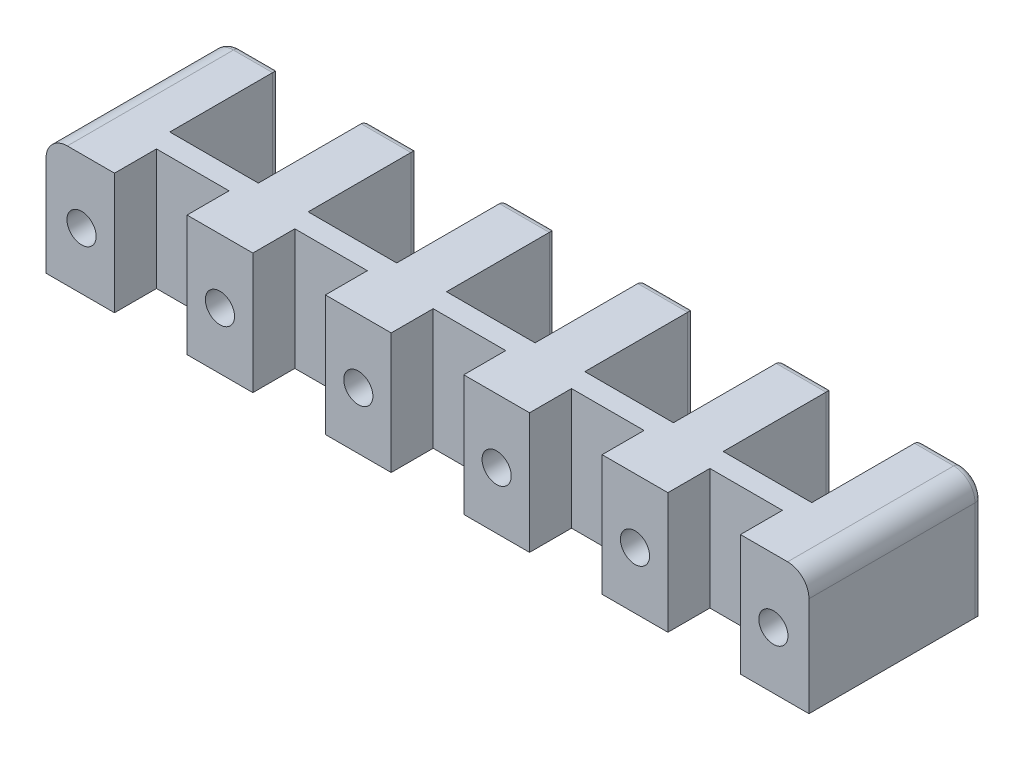
from build123d import *

# Parameters (mm, degrees)
SKETCH1_W           = 12.45
SKETCH1_H           = 21.45
BOSS_EXTRUDE1_DEPTH = 18
SKETCH2_W           = 10
SKETCH2_H           = 3
BOSS_EXTRUDE2_DEPTH = 18
SKETCH4_W           = 7
SKETCH4_H           = 8.185466936
SKETCH4_H_2         = 9.121133548
SKETCH4_H_3         = 13.415591142
SKETCH4_H_4         = 10.11507115
SKETCH4_H_5         = 8.575799248
CUT_EXTRUDE2_DEPTH  = 6
FILLET3_R           = 3.5
FILLET4_R           = 2
SKETCH5_R           = 1.6
CUT_EXTRUDE3_DEPTH  = 105.163684291
CUT_EXTRUDE4_DEPTH  = 105.163684291
SKETCH10_W          = 7.3675
SKETCH10_H          = 18
SKETCH10_R          = 1.6
BOSS_EXTRUDE4_DEPTH = 21.45
FILLET6_R           = 3
SKETCH11_W          = 114.139507882
SKETCH11_H          = 1
CUT_EXTRUDE5_DEPTH  = 97.285728563
CHAMFER1_SIZE       = 1
CHAMFER2_SIZE       = 1
FILLET7_R           = 1
FILLET8_R           = 1
FILLET9_R           = 1
SKETCH13_R          = 2.05
CUT_EXTRUDE6_DEPTH  = 8
SKETCH14_R          = 2.05
CUT_EXTRUDE7_DEPTH  = 10
SKETCH15_W          = 114.000331722
SKETCH15_H          = 33.1435942
CUT_EXTRUDE9_DEPTH  = 97.285728563


with BuildPart() as part:
    # Sketch1 → Boss-Extrude1 (new body)
    with BuildSketch(Plane(origin=(0, 0, 0), x_dir=(1, 0, 0), z_dir=(0, 1, 0))):
        Polygon((-19.225, -19.625), (-5.1, -19.625), (-5.1, -13.725), (5.1, -13.725), (5.1, -19.625), (14.35, -19.625), (14.35, -13.725), (24.55, -13.725), (24.55, -19.625), (33.8, -19.625), (33.8, -13.725), (44, -13.725), (44, -19.625), (53.25, -19.625), (53.25, -13.725), (63.45, -13.725), (63.45, -19.625), (72.7, -19.625), (72.7, -13.725), (82.9, -13.725), (82.9, -19.625), (97.025, -19.625), (97.025, -10.725), (87.025, -10.725), (87.025, 13.725), (-9.225, 13.725), (-9.225, -10.725), (-19.225, -10.725), align=None)
        Rectangle(SKETCH1_W, SKETCH1_H, mode=Mode.SUBTRACT)
        with Locations((19.45, 0)):
            Rectangle(SKETCH1_W, SKETCH1_H, mode=Mode.SUBTRACT)
        with Locations((38.9, 0)):
            Rectangle(SKETCH1_W, SKETCH1_H, mode=Mode.SUBTRACT)
        with Locations((58.35, 0)):
            Rectangle(SKETCH1_W, SKETCH1_H, mode=Mode.SUBTRACT)
        with Locations((77.8, 0)):
            Rectangle(SKETCH1_W, SKETCH1_H, mode=Mode.SUBTRACT)
    extrude(amount=BOSS_EXTRUDE1_DEPTH)

    # Sketch2 → Boss-Extrude2 (add)
    with BuildSketch(Plane(origin=(0, 18, 0), x_dir=(1, 0, 0), z_dir=(0, 1, 0))):
        with Locations((-14.225, -9.225)):
            Rectangle(SKETCH2_W, SKETCH2_H)
        with Locations((92.025, -9.225)):
            Rectangle(SKETCH2_W, SKETCH2_H)
    extrude(amount=-BOSS_EXTRUDE2_DEPTH)

    # Sketch4 → Cut-Extrude2 (cut)
    with BuildSketch(Plane(origin=(0, 18, 0), x_dir=(1, 0, 0), z_dir=(0, 1, 0))):
        with Locations((0, 10.725)):
            Rectangle(SKETCH4_W, SKETCH4_H)
        with Locations((19.45, 10.725)):
            Rectangle(SKETCH4_W, SKETCH4_H_2)
        with Locations((38.9, 10.725)):
            Rectangle(SKETCH4_W, SKETCH4_H_3)
        with Locations((58.35, 10.725)):
            Rectangle(SKETCH4_W, SKETCH4_H_4)
        with Locations((77.8, 10.725)):
            Rectangle(SKETCH4_W, SKETCH4_H_5)
    extrude(amount=-CUT_EXTRUDE2_DEPTH, mode=Mode.SUBTRACT)

    # Fillet3
    fillet3_edges = [part.edges().sort_by_distance(p)[0] for p in [
        (81.3, 12, -12.225),
        (74.3, 12, -12.225),
        (54.85, 12, -12.225),
        (61.85, 12, -12.225),
        (42.4, 12, -12.225),
        (35.4, 12, -12.225),
        (15.95, 12, -12.225),
        (22.95, 12, -12.225),
        (3.5, 12, -12.225),
        (-3.5, 12, -12.225),
    ]]
    fillet(fillet3_edges, radius=FILLET3_R - 0.0001)  # a hair under: the kernel refuses the full size

    # Fillet4
    fillet4_edges = [part.edges().sort_by_distance(p)[0] for p in [
        (74.3, 18, -12.225),
        (81.3, 18, -12.225),
        (54.85, 18, -12.225),
        (61.85, 18, -12.225),
        (35.4, 18, -12.225),
        (42.4, 18, -12.225),
        (15.95, 18, -12.225),
        (22.95, 18, -12.225),
        (-3.5, 18, -12.225),
        (3.5, 18, -12.225),
    ]]
    fillet(fillet4_edges, radius=FILLET4_R)

    # Sketch5 → Cut-Extrude3 (cut, through all)
    with BuildSketch(Plane.XY.offset(19.625)):
        with Locations((9.725, 9)):
            Circle(SKETCH5_R)
        with Locations((29.175, 9)):
            Circle(SKETCH5_R)
        with Locations((48.625, 9)):
            Circle(SKETCH5_R)
        with Locations((68.075, 9)):
            Circle(SKETCH5_R)
        with Locations((87.53, 9)):
            Circle(SKETCH5_R)
        with Locations((-9.73, 9)):
            Circle(SKETCH5_R)
    extrude(amount=-CUT_EXTRUDE3_DEPTH, mode=Mode.SUBTRACT)

    # Sketch7 → Cut-Extrude4 (cut, through all)
    with BuildSketch(Plane(origin=(0, 0, -13.725), x_dir=(-1, 0, 0), z_dir=(0, 0, -1))):
        Polygon((-92.53, 9), (-92.53, -2.934603673), (-102.870987394, -2.934603673), (-102.870987394, 21.319522162), (-92.53, 21.319522162), align=None)
        Polygon((14.73, 9), (14.73, -3.337317556), (26.94038456, -3.337317556), (26.94038456, 20.180651888), (14.73, 20.180651888), align=None)
    extrude(amount=-CUT_EXTRUDE4_DEPTH, mode=Mode.SUBTRACT)

    # Sketch10 → Boss-Extrude4 (add)
    # profile 1 of 2: a face of its own
    with BuildSketch(Plane(origin=(0, 0, 7.725), x_dir=(-1, 0, 0), z_dir=(0, 0, -1))):
        with Locations((-88.84625, 9)):
            Rectangle(SKETCH10_W, SKETCH10_H)
        with Locations(Location((-87.53, 9, 0), (0, 0, 180))):
            Circle(SKETCH10_R, mode=Mode.SUBTRACT)
    # profile 2 of 2: a face of its own
    with BuildSketch(Plane(origin=(0, 0, 7.725), x_dir=(-1, 0, 0), z_dir=(0, 0, -1))):
        with Locations((11.04625, 9)):
            Rectangle(SKETCH10_W, SKETCH10_H)
        with Locations(Location((9.73, 9, 0), (0, 0, 180))):
            Circle(SKETCH10_R, mode=Mode.SUBTRACT)
    extrude(amount=BOSS_EXTRUDE4_DEPTH)

    # Fillet6
    fillet6_edges = [part.edges().sort_by_distance(p)[0] for p in [
        (92.53, 18, 2.95),
        (-14.73, 18, 2.95),
    ]]
    fillet(fillet6_edges, radius=FILLET6_R)

    # Sketch11 → Cut-Extrude5 (cut, through all)
    with BuildSketch(Plane(origin=(0, 18, 0), x_dir=(1, 0, 0), z_dir=(0, 1, 0))):
        with Locations((38.937615411, 5.225)):
            Rectangle(SKETCH11_W, SKETCH11_H)
    extrude(amount=-CUT_EXTRUDE5_DEPTH, mode=Mode.SUBTRACT)


with BuildPart() as cut_extrude5_piece_1:
    # of the separate pieces the step leaves, piece 1, a body of its own (cut_extrude5_pieces)
    add(part.part.solids().sort_by_distance((-11.73, 18, -4.725))[0])

    # Chamfer2
    chamfer2_edges = [cut_extrude5_piece_1.edges().sort_by_distance(p)[0] for p in [
        (-9.915, 0, 19.625),
        (-14.73, 0, 7.45),
        (68.075, 0, 19.625),
        (63.45, 0, 16.675),
        (58.35, 0, 13.725),
        (53.25, 0, 16.675),
        (48.625, 0, 19.625),
        (44, 0, 16.675),
        (38.9, 0, 13.725),
        (33.8, 0, 16.675),
        (29.175, 0, 19.625),
        (24.55, 0, 16.675),
        (19.45, 0, 13.725),
        (14.35, 0, 16.675),
        (9.725, 0, 19.625),
        (5.1, 0, 16.675),
        (0, 0, 13.725),
        (-5.1, 0, 16.675),
        (92.53, 0, 7.45),
        (-6.225, 0, 3),
        (6.225, 0, 3),
        (25.675, 0, 3),
        (87.715, 0, 19.625),
        (13.225, 0, 3),
        (45.125, 0, 3),
        (32.675, 0, 3),
        (64.575, 0, 3),
        (52.125, 0, 3),
        (84.025, 0, 3),
        (71.575, 0, 3),
        (82.9, 0, 16.675),
        (77.8, 0, 13.725),
        (72.7, 0, 16.675),
        (77.8, 0, 10.725),
        (9.725, 0, -4.725),
        (88.2775, 0, -4.725),
        (68.075, 0, -4.725),
        (48.625, 0, -4.725),
        (29.175, 0, -4.725),
        (-10.4775, 0, -4.725),
        (58.35, 0, 10.725),
        (38.9, 0, 10.725),
        (19.45, 0, 10.725),
        (0, 0, 10.725),
    ]]
    chamfer(chamfer2_edges, length=CHAMFER2_SIZE)

    # Fillet7
    fillet7_edges = [cut_extrude5_piece_1.edges().sort_by_distance(p)[0] for p in [
        (91.651320344, 17.121320344, -4.725),
        (71.575, 9.5, -4.725),
        (52.125, 9.5, -4.725),
        (32.675, 9.5, -4.725),
        (13.225, 9.5, -4.725),
        (6.225, 9.5, -4.725),
        (84.025, 9.5, -4.725),
        (64.575, 9.5, -4.725),
        (45.125, 9.5, -4.725),
        (25.675, 9.5, -4.725),
        (-6.225, 9.5, -4.725),
        (-14.73, 8, -4.725),
        (-13.851320344, 17.121320344, -4.725),
        (9.725, 18, -4.725),
        (86.7775, 18, -4.725),
        (68.075, 18, -4.725),
        (48.625, 18, -4.725),
        (29.175, 18, -4.725),
        (-8.9775, 18, -4.725),
        (92.53, 8, -4.725),
    ]]
    fillet(fillet7_edges, radius=FILLET7_R)

    # Sketch13 → Cut-Extrude6 (cut)
    with BuildSketch(Plane.XY.offset(19.625)):
        with Locations((-9.73, 9)):
            Circle(SKETCH13_R)
        with Locations((9.725, 9)):
            Circle(SKETCH13_R)
        with Locations((29.175, 9)):
            Circle(SKETCH13_R)
        with Locations((48.625, 9)):
            Circle(SKETCH13_R)
        with Locations((68.075, 9)):
            Circle(SKETCH13_R)
        with Locations((87.53, 9)):
            Circle(SKETCH13_R)
    extrude(amount=-CUT_EXTRUDE6_DEPTH, mode=Mode.SUBTRACT)

    # Sketch14 → Cut-Extrude7 (cut)
    with BuildSketch(Plane(origin=(0, 0, -4.725), x_dir=(-1, 0, 0), z_dir=(0, 0, -1))):
        with Locations(Location((-87.53, 9, 0), (0, 0, 180))):
            Circle(SKETCH14_R)
        with Locations(Location((-68.075, 9, 0), (0, 0, 180))):
            Circle(SKETCH14_R)
        with Locations(Location((-48.625, 9, 0), (0, 0, 180))):
            Circle(SKETCH14_R)
        with Locations(Location((-29.175, 9, 0), (0, 0, 180))):
            Circle(SKETCH14_R)
        with Locations(Location((-9.725, 9, 0), (0, 0, 180))):
            Circle(SKETCH14_R)
        with Locations(Location((9.73, 9, 0), (0, 0, 180))):
            Circle(SKETCH14_R)
    extrude(amount=-CUT_EXTRUDE7_DEPTH, mode=Mode.SUBTRACT)


with BuildPart() as cut_extrude5_piece_2:
    # of the separate pieces the step leaves, piece 2, a body of its own (cut_extrude5_pieces)
    add(part.part.solids().sort_by_distance((-11.73, 18, -13.725))[0])

    # Chamfer1
    chamfer1_edges = [cut_extrude5_piece_2.edges().sort_by_distance(p)[0] for p in [
        (77.8, 0, -10.725),
        (58.35, 0, -10.725),
        (38.9, 0, -10.725),
        (6.225, 0, -8.225),
        (19.45, 0, -10.725),
        (0, 0, -10.725),
        (84.025, 0, -8.225),
        (64.575, 0, -8.225),
        (45.125, 0, -8.225),
        (25.675, 0, -8.225),
        (92.53, 0, -9.725),
        (88.2775, 0, -5.725),
        (71.575, 0, -8.225),
        (68.075, 0, -5.725),
        (52.125, 0, -8.225),
        (48.625, 0, -5.725),
        (32.675, 0, -8.225),
        (29.175, 0, -5.725),
        (13.225, 0, -8.225),
        (9.725, 0, -5.725),
        (-6.225, 0, -8.225),
        (-10.4775, 0, -5.725),
        (-14.73, 0, -9.725),
        (38.9, 0, -13.725),
    ]]
    chamfer(chamfer1_edges, length=CHAMFER1_SIZE)

    # Fillet8
    fillet8_edges = [cut_extrude5_piece_2.edges().sort_by_distance(p)[0] for p in [
        (-14.73, 8, -5.725),
        (-6.225, 9.5, -5.725),
        (6.225, 9.5, -5.725),
        (13.225, 9.5, -5.725),
        (25.675, 9.5, -5.725),
        (32.675, 9.5, -5.725),
        (45.125, 9.5, -5.725),
        (52.125, 9.5, -5.725),
        (64.575, 9.5, -5.725),
        (71.575, 9.5, -5.725),
        (84.025, 9.5, -5.725),
        (91.651320344, 17.121320344, -5.725),
        (86.7775, 18, -5.725),
        (-8.9775, 18, -5.725),
        (-13.851320344, 17.121320344, -5.725),
        (9.725, 18, -5.725),
        (29.175, 18, -5.725),
        (48.625, 18, -5.725),
        (68.075, 18, -5.725),
        (92.53, 8, -5.725),
    ]]
    fillet(fillet8_edges, radius=FILLET8_R)

    # Fillet9
    fillet9_edges = [cut_extrude5_piece_2.edges().sort_by_distance(p)[0] for p in [
        (-2.474903023, 13.025096977, -13.725),
        (2.474903023, 13.025096977, -13.725),
        (4.085786438, 17.414213562, -13.725),
        (9.725, 18, -13.725),
        (15.364213562, 17.414213562, -13.725),
        (16.975096977, 13.025096977, -13.725),
        (21.924903023, 13.025096977, -13.725),
        (23.535786438, 17.414213562, -13.725),
        (29.175, 18, -13.725),
        (34.814213562, 17.414213562, -13.725),
        (36.425096977, 13.025096977, -13.725),
        (41.374903023, 13.025096977, -13.725),
        (42.985786438, 17.414213562, -13.725),
        (48.625, 18, -13.725),
        (54.264213562, 17.414213562, -13.725),
        (55.875096977, 13.025096977, -13.725),
        (60.824903023, 13.025096977, -13.725),
        (62.435786438, 17.414213562, -13.725),
        (68.075, 18, -13.725),
        (73.714213562, 17.414213562, -13.725),
        (75.325096977, 13.025096977, -13.725),
        (80.274903023, 13.025096977, -13.725),
        (81.885786438, 17.414213562, -13.725),
        (86.415, 18, -13.725),
        (91.651320344, 17.121320344, -13.725),
        (92.53, 8, -13.725),
        (-14.73, 8, -13.725),
        (81.3, 15.74995, -13.725),
        (74.3, 15.74995, -13.725),
        (61.85, 15.74995, -13.725),
        (54.85, 15.74995, -13.725),
        (42.4, 15.74995, -13.725),
        (35.4, 15.74995, -13.725),
        (22.95, 15.74995, -13.725),
        (15.95, 15.74995, -13.725),
        (3.5, 15.74995, -13.725),
        (-3.5, 15.74995, -13.725),
        (-13.851320344, 17.121320344, -13.725),
        (-8.615, 18, -13.725),
        (-4.085786438, 17.414213562, -13.725),
    ]]
    fillet(fillet9_edges, radius=FILLET9_R)

    # Sketch15 → Cut-Extrude9 (cut, through all)
    with BuildSketch(Plane.XZ):
        with Locations((36.723202727, -21.801193098)):
            Rectangle(SKETCH15_W, SKETCH15_H)
    extrude(amount=-CUT_EXTRUDE9_DEPTH, mode=Mode.SUBTRACT)


solid = cut_extrude5_piece_1.part
